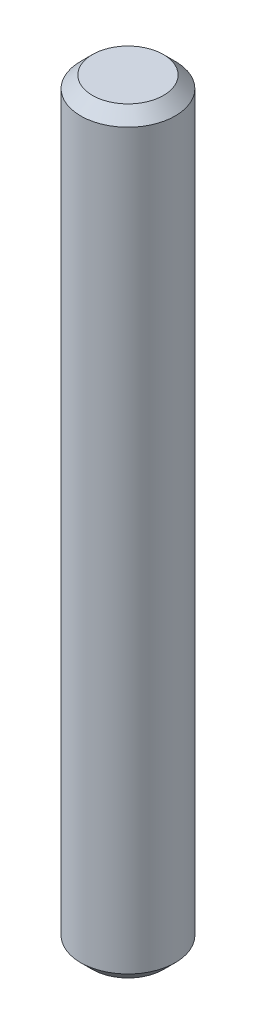
from build123d import *

# Parameters (mm, degrees)
SKETCH1_R           = 1.5875
BOSS_EXTRUDE1_DEPTH = 25.4
CHAMFER1_SIZE       = 0.396875


with BuildPart() as part:
    # Sketch1 → Boss-Extrude1 (new body)
    with BuildSketch(Plane(origin=(0, 0, 0), x_dir=(1, 0, 0), z_dir=(0, 1, 0))):
        Circle(SKETCH1_R)
    extrude(amount=BOSS_EXTRUDE1_DEPTH)

    # Chamfer1
    chamfer1_edges = [part.edges().sort_by_distance(p)[0] for p in [
        (-1.5875, 0, 0),
        (-1.5875, 25.4, 0),
    ]]
    chamfer(chamfer1_edges, length=CHAMFER1_SIZE)


solid = part.part
